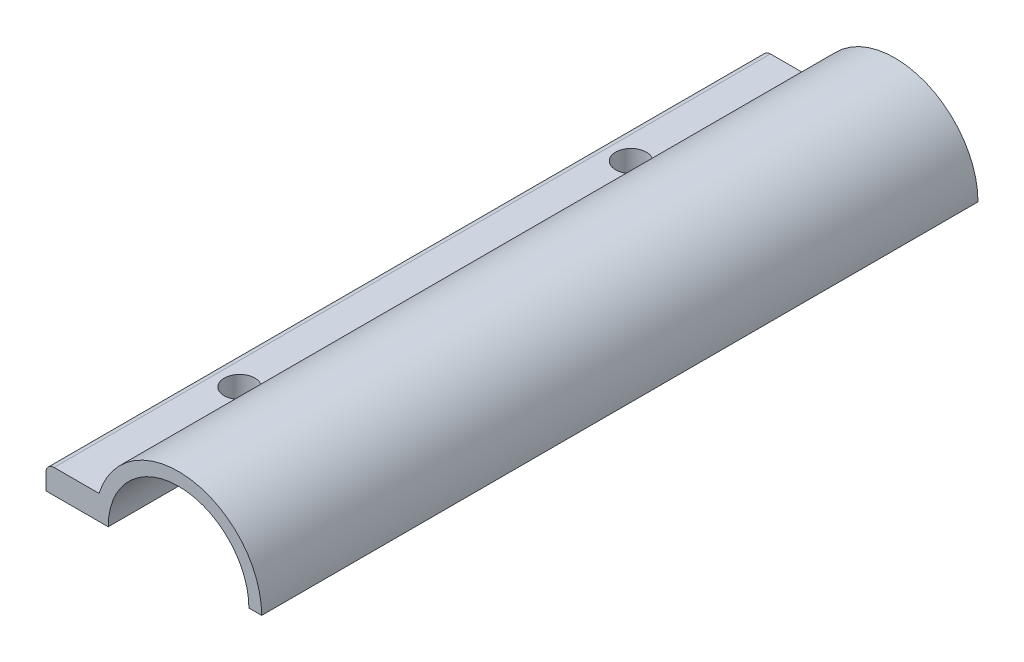
from build123d import *

# Parameters (mm, degrees)
BOSS_EXTRUDE1_DEPTH  = 112
FILLET1_R            = 1.27
M4_CLEARANCE_HOLE1_D = 4.8


with BuildPart() as part:
    # Sketch1 → Boss-Extrude1 (new body)
    with BuildSketch(Plane.XY):
        with BuildLine():
            Line((-12.429155241, 3.81), (-20.724457785, 3.81))
            Line((-20.724457785, 3.81), (-20.724457785, 0))
            Line((-20.724457785, 0), (-11, 0))
            ThreePointArc((-11, 0), (0, 11), (11, 0))
            Line((11, 0), (13, 0))
            ThreePointArc((13, 0), (1.926263465, 12.856496765), (-12.429155241, 3.81))
        make_face()
    extrude(amount=BOSS_EXTRUDE1_DEPTH)

    # Fillet1
    fillet1_edges = [part.edges().sort_by_distance(p)[0] for p in [
        (-20.724457785, 3.81, 56),
    ]]
    fillet(fillet1_edges, radius=FILLET1_R)

    # M4 Clearance Hole1 (through all)
    with Locations(Plane(origin=(0, 3.81, 0), x_dir=(1, 0, 0), z_dir=(0, 1, 0))):
        with Locations((-15.862228893, -25.4), (-15.862228893, -86.6)):
            Hole(M4_CLEARANCE_HOLE1_D / 2)


solid = part.part
